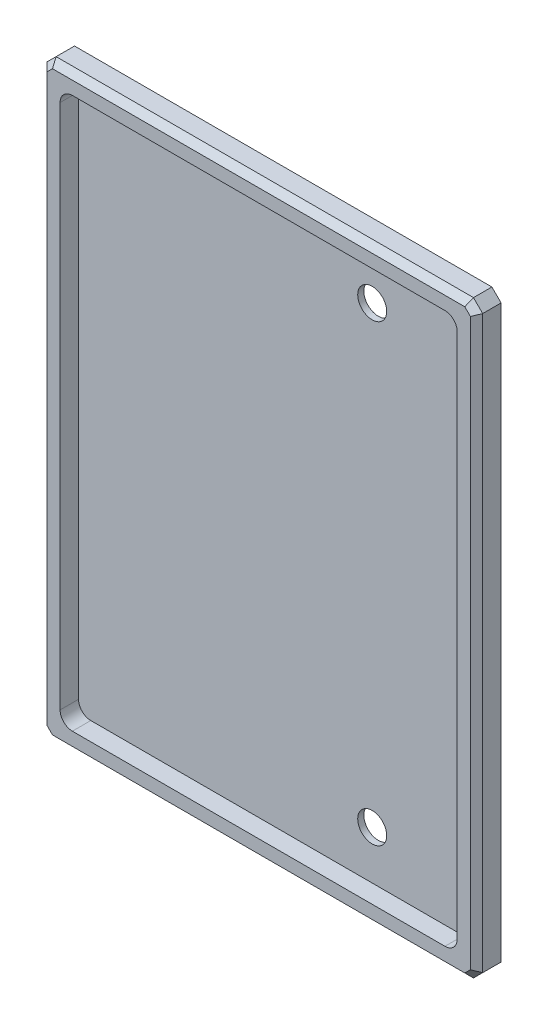
from build123d import *

# Parameters (mm, degrees)
SKETCH1_W                 = 225.425
SKETCH1_H                 = 304.8
BOSS_EXTRUDE1_DEPTH       = 12.7
CUT_EXTRUDE1_DEPTH        = 9.525
SKETCH4_R                 = 7.5
CUT_EXTRUDE3_DEPTH        = 190.976729249
M4X0_7_TAPPED_HOLE1_D     = 3.3
M4X0_7_TAPPED_HOLE1_DEPTH = 5.4
M4X0_7_TAPPED_HOLE1_TIP   = 0.991420021
CHAMFER1_SIZE             = 4.7625
CHAMFER2_SIZE             = 3.175


with BuildPart() as part:
    # Sketch1 → Boss-Extrude1 (new body)
    with BuildSketch(Plane.XY):
        Rectangle(SKETCH1_W, SKETCH1_H)
    extrude(amount=BOSS_EXTRUDE1_DEPTH)

    # Sketch2 → Cut-Extrude1 (cut)
    with BuildSketch(Plane.XY.offset(12.7)):
        with BuildLine():
            Line((96.3625, -142.4), (-96.3625, -142.4))
            ThreePointArc((-96.3625, -142.4), (-100.852628061, -140.540128061), (-102.7125, -136.05))
            Line((-102.7125, -136.05), (-102.7125, 136.05))
            ThreePointArc((-102.7125, 136.05), (-100.852628061, 140.540128061), (-96.3625, 142.4))
            Line((-96.3625, 142.4), (96.3625, 142.4))
            ThreePointArc((96.3625, 142.4), (100.852628061, 140.540128061), (102.7125, 136.05))
            Line((102.7125, 136.05), (102.7125, -136.05))
            ThreePointArc((102.7125, -136.05), (100.852628061, -140.540128061), (96.3625, -142.4))
        make_face()
    extrude(amount=-CUT_EXTRUDE1_DEPTH, mode=Mode.SUBTRACT)

    # Sketch4 → Cut-Extrude3 (cut, through all)
    with BuildSketch(Plane(origin=(0, 0, 0), x_dir=(-1, 0, 0), z_dir=(0, 0, -1))):
        with Locations((-49.2125, -117.4)):
            Circle(SKETCH4_R)
        with Locations((-49.2125, 117.4)):
            Circle(SKETCH4_R)
    extrude(amount=-CUT_EXTRUDE3_DEPTH, mode=Mode.SUBTRACT)

    # M4x0.7 Tapped Hole1
    with Locations(Plane(origin=(0, 0, 0), x_dir=(-1, 0, 0), z_dir=(0, 0, -1))):
        with Locations((109.5375, -113.6), (109.5375, 113.6)):
            Hole(M4X0_7_TAPPED_HOLE1_D / 2, depth=M4X0_7_TAPPED_HOLE1_DEPTH)
            with Locations((0, 0, -(M4X0_7_TAPPED_HOLE1_DEPTH + M4X0_7_TAPPED_HOLE1_TIP / 2))):  # 118° drill point
                Cone(0, M4X0_7_TAPPED_HOLE1_D / 2, M4X0_7_TAPPED_HOLE1_TIP, mode=Mode.SUBTRACT)

    # Chamfer1
    chamfer1_edges = [part.edges().sort_by_distance(p)[0] for p in [
        (-112.7125, 152.4, 6.35),
        (112.7125, 152.4, 6.35),
        (112.7125, -152.4, 6.35),
        (-112.7125, -152.4, 6.35),
    ]]
    chamfer(chamfer1_edges, length=CHAMFER1_SIZE)

    # Chamfer2
    chamfer2_edges = [part.edges().sort_by_distance(p)[0] for p in [
        (110.33125, -150.01875, 12.7),
        (112.7125, 0, 12.7),
        (110.33125, 150.01875, 12.7),
        (0, 152.4, 12.7),
        (-110.33125, 150.01875, 12.7),
        (-112.7125, 0, 12.7),
        (-110.33125, -150.01875, 12.7),
        (0, -152.4, 12.7),
    ]]
    chamfer(chamfer2_edges, length=CHAMFER2_SIZE)


solid = part.part
